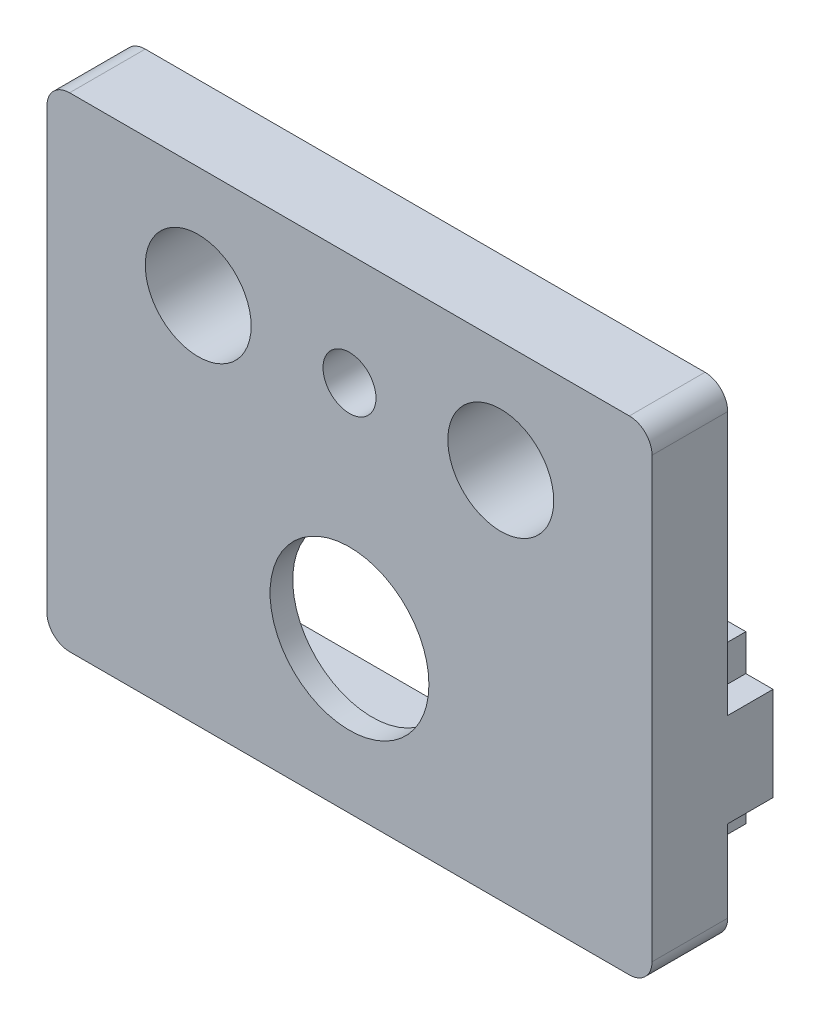
from build123d import *

# Parameters (mm, degrees)
SKETCH_1_W          = 40
SKETCH_1_H          = 20
EXTRUDE_1_DEPTH     = 3.5
SKETCH_2_W          = 40
SKETCH_2_H          = 20
SKETCH_2_R          = 5.25
EXTRUDE_2_DEPTH     = 1.5
EXTRUDE_3_DEPTH     = 8
SKETCH_4_W          = 40
SKETCH_4_H          = 12
SKETCH_4_R          = 3.5
EXTRUDE_4_DEPTH     = 5
FILLET_1_R          = 1.5
SKETCH_5_R          = 1.75
CUT_EXTRUDE_1_DEPTH = 5


with BuildPart() as part:
    # 草图1 → 凸台-拉伸1 (new body)
    with BuildSketch(Plane.XY):
        Rectangle(SKETCH_1_W, SKETCH_1_H)
        with BuildLine():
            Line((-9.5, -5.75), (9.5, -5.75))
            ThreePointArc((9.5, -5.75), (11, 0), (9.5, 5.75))
            Line((9.5, 5.75), (-9.5, 5.75))
            ThreePointArc((-9.5, 5.75), (-11, 0), (-9.5, -5.75))
        make_face(mode=Mode.SUBTRACT)
    extrude(amount=EXTRUDE_1_DEPTH)

    # 草图2 → 凸台-拉伸2 (add)
    with BuildSketch(Plane.XY.offset(3.5)):
        Rectangle(SKETCH_2_W, SKETCH_2_H)
        Circle(SKETCH_2_R, mode=Mode.SUBTRACT)
    extrude(amount=EXTRUDE_2_DEPTH)

    # 草图3 → 凸台-拉伸3 (add)
    with BuildSketch(Plane.XY.offset(5)):
        Polygon((-16.560660172, 5.5), (-18.2, 5.5), (-18.2, 3.1), (-20, 3.1), (-20, -3.1), (-18.2, -3.1), (-18.2, -5.5), (-16.560660172, -5.5), (-13.9, -2.839339828), (-13.9, 2.839339828), align=None)
        Polygon((18.2, 3.1), (20, 3.1), (20, -3.1), (18.2, -3.1), (18.2, -5.5), (16.560660172, -5.5), (13.9, -2.839339828), (13.9, 2.839339828), (16.560660172, 5.5), (18.2, 5.5), align=None)
    extrude(amount=-EXTRUDE_3_DEPTH)

    # 草图4 → 凸台-拉伸4 (add)
    with BuildSketch(Plane.XY.offset(5)):
        with Locations((0, 16)):
            Rectangle(SKETCH_4_W, SKETCH_4_H)
        with Locations((-10, 14.64)):
            Circle(SKETCH_4_R, mode=Mode.SUBTRACT)
        with Locations((10, 14.64)):
            Circle(SKETCH_4_R, mode=Mode.SUBTRACT)
    extrude(amount=-EXTRUDE_4_DEPTH)

    # 圆角1
    fillet_1_edges = [part.edges().sort_by_distance(p)[0] for p in [
        (-20, 22, 2.5),
        (20, 22, 2.5),
        (20, -10, 2.5),
        (-20, -10, 2.5),
    ]]
    fillet(fillet_1_edges, radius=FILLET_1_R)

    # 草图5 → 切除-拉伸1 (cut)
    with BuildSketch(Plane.XY.offset(5)):
        with Locations((0, 14.64)):
            Circle(SKETCH_5_R)
    extrude(amount=-CUT_EXTRUDE_1_DEPTH, mode=Mode.SUBTRACT)


solid = part.part
